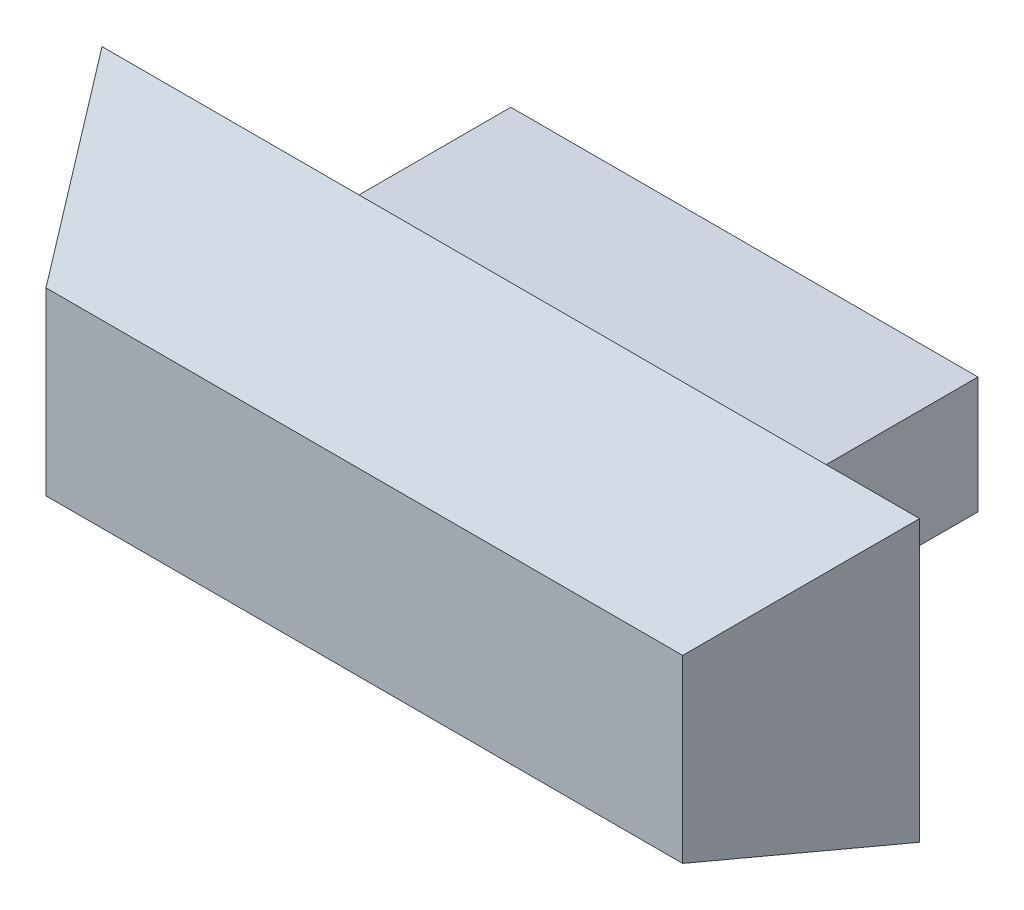
from build123d import *

# Parameters (mm, degrees)
SKETCH1_W           = 11.1125
SKETCH1_H           = 3.81
BOSS_EXTRUDE1_DEPTH = 2.54
CHAMFER1_SIZE       = 2.54
CHAMFER1_SIZE_2     = 1.778527147
CHAMFER2_SIZE       = 0.680590949
CHAMFER2_SIZE_2     = 2.54
SKETCH2_W           = 6.35
SKETCH2_H           = 1.5875
BOSS_EXTRUDE2_DEPTH = 3.175


with BuildPart() as part:
    # Sketch1 → Boss-Extrude1 (new body)
    with BuildSketch(Plane.XY):
        with Locations((77.94625, 65.532)):
            Rectangle(SKETCH1_W, SKETCH1_H)
    extrude(amount=BOSS_EXTRUDE1_DEPTH)

    # Chamfer1
    # the kernel refuses this chamfer: 2.54, 1.778527147 mm, written as the material it takes off along each edge
    with BuildSketch(Plane(origin=(72.39, 73.996682665, 2.54), x_dir=(-0.02220967419845826, 0, -0.9997533347641299), z_dir=(0, -1, 0))) as chamfer1_piece_1:
        Polygon((CHAMFER1_SIZE * 0.999753334764, CHAMFER1_SIZE * 0.0222096741985), (-CHAMFER1_SIZE_2 * 0.0222096741991, CHAMFER1_SIZE_2 * 0.999753334794), (0, 0), align=None)
    extrude(amount=16.92936533, mode=Mode.SUBTRACT)

    # Chamfer2
    # the kernel refuses this chamfer: 2.54, 0.680590949 mm, written as the material it takes off along each edge
    with BuildSketch(Plane(origin=(67.572854359, 63.627, 2.54), x_dir=(0, 0.9905000388259545, 0.13751244702128823), z_dir=(1, 0, 0))) as chamfer2_piece_1:
        Polygon((CHAMFER2_SIZE * 0.990500038499, -CHAMFER2_SIZE * 0.137512446976), (-CHAMFER2_SIZE_2 * 0.137512447021, -CHAMFER2_SIZE_2 * 0.990500038826), (0, 0), align=None)
    extrude(amount=22.52531843, mode=Mode.SUBTRACT)
    with BuildSketch(Plane(origin=(83.5025, 57.031327212, 2.54), x_dir=(-0.9905000388259543, 0, 0.13751244702128956), z_dir=(0, 1, 0))) as chamfer2_piece_2:
        Polygon((CHAMFER2_SIZE * 0.990500038499, -CHAMFER2_SIZE * 0.137512446976), (-CHAMFER2_SIZE_2 * 0.137512447021, -CHAMFER2_SIZE_2 * 0.990500038826), (0, 0), align=None)
    extrude(amount=17.001345577, mode=Mode.SUBTRACT)
    with BuildSketch(Plane(origin=(90.098172788, 67.437, 2.54), x_dir=(0, 0.009967146577158238, -0.9999503267608394), z_dir=(-1, 0, 0))) as chamfer2_piece_3:
        Polygon((CHAMFER2_SIZE_2 * 0.999950326761, CHAMFER2_SIZE_2 * 0.00996714657716), (-CHAMFER2_SIZE * 0.00996714657386, CHAMFER2_SIZE * 0.99995032643), (0, 0), align=None)
    extrude(amount=22.52531843, mode=Mode.SUBTRACT)

    # Sketch2 → Boss-Extrude2 (add)
    with BuildSketch(Plane(origin=(0, 0, 0), x_dir=(-1, 0, 0), z_dir=(0, 0, -1))):
        with Locations((-77.94625, 65.532)):
            Rectangle(SKETCH2_W, SKETCH2_H)
    extrude(amount=BOSS_EXTRUDE2_DEPTH)


solid = part.part
